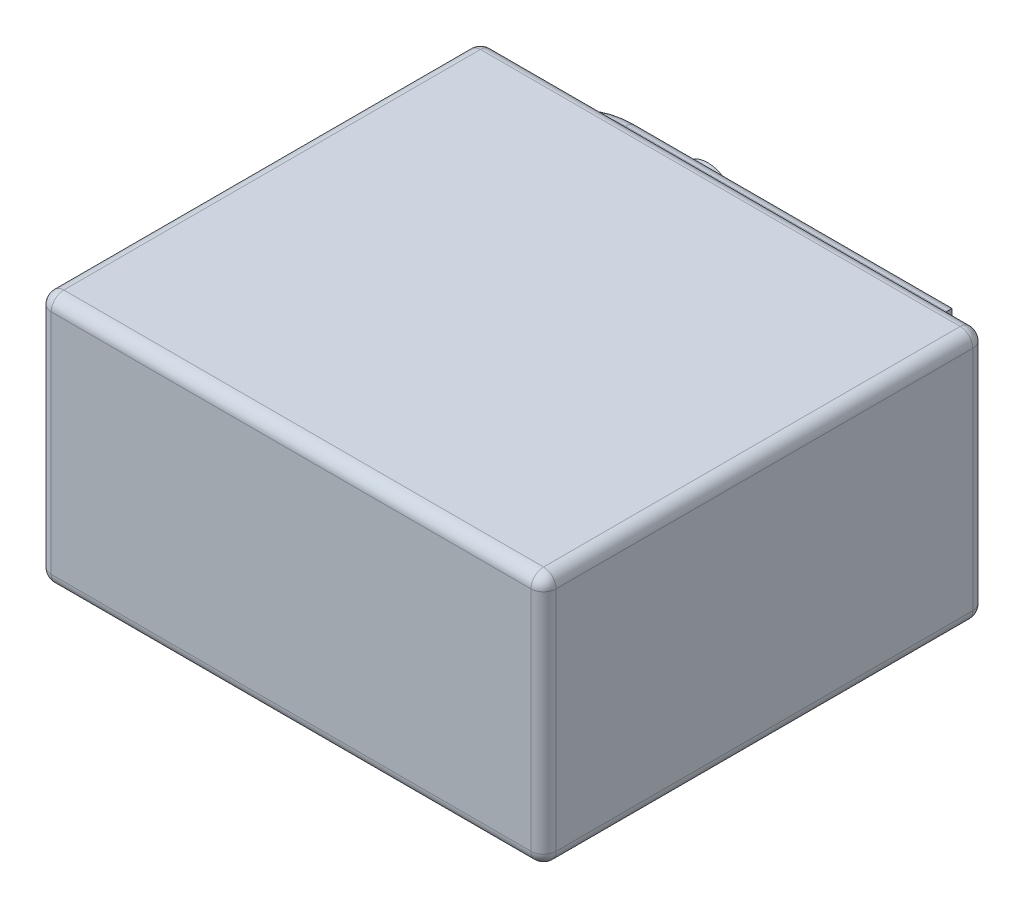
from build123d import *

# Parameters (mm, degrees)
SKETCH_1_W      = 40
SKETCH_1_H      = 20
EXTRUDE_1_DEPTH = 35
FILLET_1_R      = 1
SKETCH_2_R      = 2.240395976
EXTRUDE_2_DEPTH = 8
EXTRUDE_3_DEPTH = 2.5
FILLET_2_R      = 1


with BuildPart() as part:
    # 草图1 → 凸台-拉伸1 (new body)
    with BuildSketch(Plane.XY):
        Rectangle(SKETCH_1_W, SKETCH_1_H)
    extrude(amount=EXTRUDE_1_DEPTH)

    # 圆角1
    fillet_1_edges = [part.edges().sort_by_distance(p)[0] for p in [
        (-20, 0, 35),
        (0, -10, 35),
        (20, 0, 35),
        (0, -10, 0),
        (-20, 0, 0),
        (0, 10, 0),
        (20, 0, 0),
        (0, 10, 35),
        (20, -10, 17.5),
        (-20, -10, 17.5),
        (-20, 10, 17.5),
        (20, 10, 17.5),
    ]]
    fillet(fillet_1_edges, radius=FILLET_1_R)

    # 草图2 → 凸台-拉伸2 (add)
    with BuildSketch(Plane(origin=(0, 0, 0), x_dir=(-1, 0, 0), z_dir=(0, 0, -1))):
        with Locations(Location((10, 0, 0), (0, 0, 180))):
            Circle(SKETCH_2_R)
    extrude(amount=EXTRUDE_2_DEPTH)

    # 草图3 → 凸台-拉伸3 (add)
    with BuildSketch(Plane(origin=(0, 0, 0), x_dir=(-1, 0, 0), z_dir=(0, 0, -1))):
        with BuildLine():
            Line((-15.444071046, 8), (-15.444071046, -8))
            Line((-15.444071046, -8), (10, -8))
            ThreePointArc((10, -8), (18, 0), (10, 8))
            Line((10, 8), (-15.444071046, 8))
        make_face()
    extrude(amount=EXTRUDE_3_DEPTH)

    # 圆角2
    fillet_2_edges = [part.edges().sort_by_distance(p)[0] for p in [
        (-18, 0, 0),
        (2.722035523, 8, 0),
        (15.444071046, 0, 0),
        (2.722035523, -8, 0),
        (15.444071046, -8, -1.25),
        (-18, 0, -2.5),
        (2.722035523, 8, -2.5),
        (15.444071046, 0, -2.5),
        (2.722035523, -8, -2.5),
    ]]
    fillet(fillet_2_edges, radius=FILLET_2_R - 0.0001)  # a hair under: the kernel refuses the full size


solid = part.part
